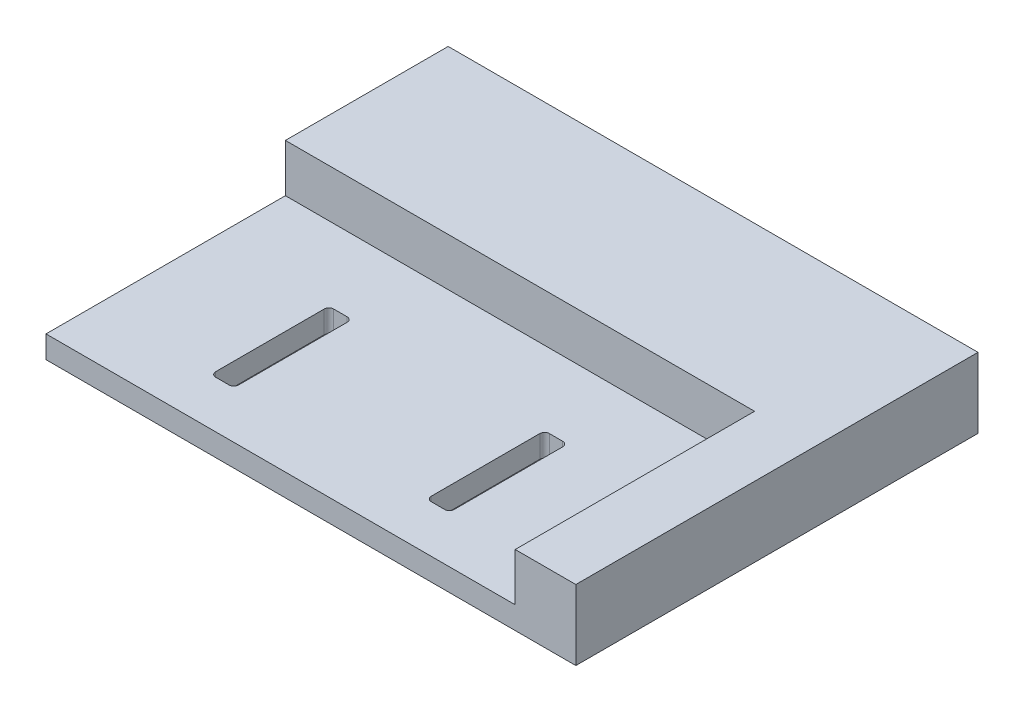
from build123d import *

# Parameters (mm, degrees)
SKETCH1_W           = 166
SKETCH1_H           = 126
BOSS_EXTRUDE1_DEPTH = 7
BOSS_EXTRUDE2_DEPTH = 15
CUT_EXTRUDE1_REACH  = 107.276


with BuildPart() as part:
    # Sketch1 → Boss-Extrude1 (new body)
    with BuildSketch(Plane(origin=(0, 0, 0), x_dir=(1, 0, 0), z_dir=(0, 1, 0))):
        Rectangle(SKETCH1_W, SKETCH1_H)
    extrude(amount=BOSS_EXTRUDE1_DEPTH)

    # Sketch2 → Boss-Extrude2 (add)
    with BuildSketch(Plane(origin=(0, 7, 0), x_dir=(1, 0, 0), z_dir=(0, 1, 0))):
        Polygon((-83, 63), (-83, 12), (64, 12), (64, -63), (83, -63), (83, 63), align=None)
    extrude(amount=BOSS_EXTRUDE2_DEPTH)

    # Sketch3 → Cut-Extrude1 (cut, up to next)
    with BuildSketch(Plane(origin=(0, 7, 0), x_dir=(1, 0, 0), z_dir=(0, 1, 0)), mode=Mode.PRIVATE) as cut_extrude1_sk1:
        with BuildLine():
            Line((-44.67, -11.18), (-40.47, -11.18))
            ThreePointArc((-40.47, -11.18), (-39.409339828, -11.619339828), (-38.97, -12.68))
            Line((-38.97, -12.68), (-38.97, -46.68))
            ThreePointArc((-38.97, -46.68), (-39.409339828, -47.740660172), (-40.47, -48.18))
            Line((-40.47, -48.18), (-44.67, -48.18))
            ThreePointArc((-44.67, -48.18), (-45.730660172, -47.740660172), (-46.17, -46.68))
            Line((-46.17, -46.68), (-46.17, -12.68))
            ThreePointArc((-46.17, -12.68), (-45.730660172, -11.619339828), (-44.67, -11.18))
        make_face()
    cut_extrude1_tool1 = extrude(cut_extrude1_sk1.sketch, amount=-CUT_EXTRUDE1_REACH, mode=Mode.PRIVATE) & part.part
    # Sketch3 → Cut-Extrude1 (cut, up to next)
    with BuildSketch(Plane(origin=(0, 7, 0), x_dir=(1, 0, 0), z_dir=(0, 1, 0)), mode=Mode.PRIVATE) as cut_extrude1_sk2:
        with BuildLine():
            Line((22.89, -11.19), (27.09, -11.19))
            ThreePointArc((27.09, -11.19), (28.150660172, -11.629339828), (28.59, -12.69))
            Line((28.59, -12.69), (28.59, -46.69))
            ThreePointArc((28.59, -46.69), (28.150660172, -47.750660172), (27.09, -48.19))
            Line((27.09, -48.19), (22.89, -48.19))
            ThreePointArc((22.89, -48.19), (21.829339828, -47.750660172), (21.39, -46.69))
            Line((21.39, -46.69), (21.39, -12.69))
            ThreePointArc((21.39, -12.69), (21.829339828, -11.629339828), (22.89, -11.19))
        make_face()
    cut_extrude1_tool2 = extrude(cut_extrude1_sk2.sketch, amount=-CUT_EXTRUDE1_REACH, mode=Mode.PRIVATE) & part.part
    add(cut_extrude1_tool1.solids().sort_by_distance((-42.57, 7, 29.68))[0], mode=Mode.SUBTRACT)
    add(cut_extrude1_tool2.solids().sort_by_distance((24.99, 7, 29.69))[0], mode=Mode.SUBTRACT)


solid = part.part
